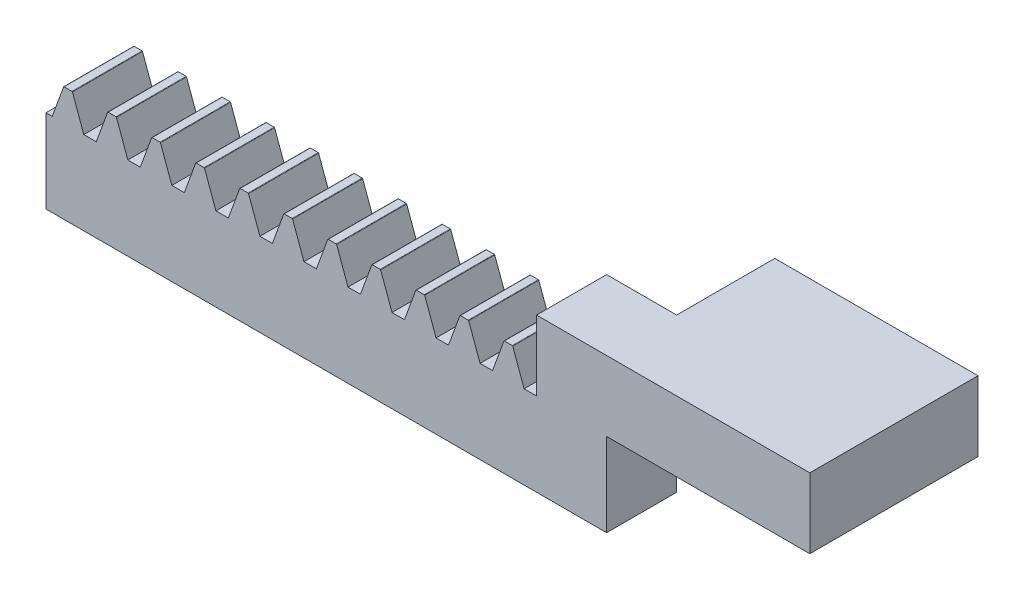
from build123d import *

# Parameters (mm, degrees)
BLANKSKE_W          = 40
BLANKSKE_H          = 8.2
BLANK_DEPTH         = 5
TOOTHCUTILL_DEPTH   = 42.136844799
TOOTHCUTSIM_DEPTH   = 42.136844799
TEETHCUTS_COUNT     = 14
TEETHCUTS_PITCH     = 3.14159265
SKETCH1_W           = 4.99804548
SKETCH1_H           = 2.25
BOSS_EXTRUDE1_DEPTH = 5
SKETCH4_W           = 12
SKETCH4_H           = 2.25
BOSS_EXTRUDE4_DEPTH = 14.5
BOSS_EXTRUDE5_DEPTH = 2.75


with BuildPart() as part:
    # BlankSke → Blank (new body)
    with BuildSketch(Plane.XY):
        with Locations((20, 4.1)):
            Rectangle(BLANKSKE_W, BLANKSKE_H)
    extrude(amount=-BLANK_DEPTH)

    # TooCutSkeIll → ToothCutIll (cut, through all)
    with BuildSketch(Plane.XY):
        with BuildLine():
            Line((-1.253788993, 8.173680806), (-0.504546125, 6.115152944))
            ThreePointArc((-0.504546125, 6.115152944), (-0.412650963, 5.995392837), (-0.268683278, 5.95))
            Line((-0.268683278, 5.95), (0.268683278, 5.95))
            ThreePointArc((0.268683278, 5.95), (0.412650963, 5.995392837), (0.504546125, 6.115152944))
            Line((0.504546125, 6.115152944), (1.253788993, 8.173680806))
            ThreePointArc((1.253788993, 8.173680806), (1.268433641, 8.192766082), (1.291376698, 8.2))
            Line((1.291376698, 8.2), (1.291376698, 8.2254))
            Line((1.291376698, 8.2254), (-1.291376698, 8.2254))
            Line((-1.291376698, 8.2254), (-1.291376698, 8.2))
            ThreePointArc((-1.291376698, 8.2), (-1.268433641, 8.192766082), (-1.253788993, 8.173680806))
        make_face()
    toothcutill = extrude(amount=-TOOTHCUTILL_DEPTH, mode=Mode.SUBTRACT)

    # TooCutSkeSim → ToothCutSim (cut, through all)
    with BuildSketch(Plane.XY):
        Polygon((0.44443537, 5.95), (-0.44443537, 5.95), (-1.272613241, 8.2254), (1.272613241, 8.2254), align=None)
    toothcutsim = extrude(amount=-TOOTHCUTSIM_DEPTH, mode=Mode.SUBTRACT)

    # TeethCuts: ToothCutIll, ToothCutSim ×14
    with Locations(*[(i * TEETHCUTS_PITCH, 0, 0) for i in range(1, TEETHCUTS_COUNT)]):
        add(toothcutill, mode=Mode.SUBTRACT)
        add(toothcutsim, mode=Mode.SUBTRACT)

    # Sketch1 → Boss-Extrude1 (add)
    with BuildSketch(Plane.XY):
        with Locations((37.50097726, 7.075)):
            Rectangle(SKETCH1_W, SKETCH1_H)
    extrude(amount=-BOSS_EXTRUDE1_DEPTH)

    # Sketch4 → Boss-Extrude4 (add)
    with BuildSketch(Plane(origin=(40, 0, 0), x_dir=(0, 0, -1), z_dir=(1, 0, 0))):
        with Locations((6, 7.075)):
            Rectangle(SKETCH4_W, SKETCH4_H)
    extrude(amount=BOSS_EXTRUDE4_DEPTH)

    # Sketch6 → Boss-Extrude5 (add)
    with BuildSketch(Plane(origin=(0, 8.2, 0), x_dir=(1, 0, 0), z_dir=(0, 1, 0))):
        Polygon((35.00195452, 5), (35.00195452, 0), (54.5, 0), (54.5, 12), (40, 12), (40, 5), align=None)
    extrude(amount=BOSS_EXTRUDE5_DEPTH)


solid = part.part
